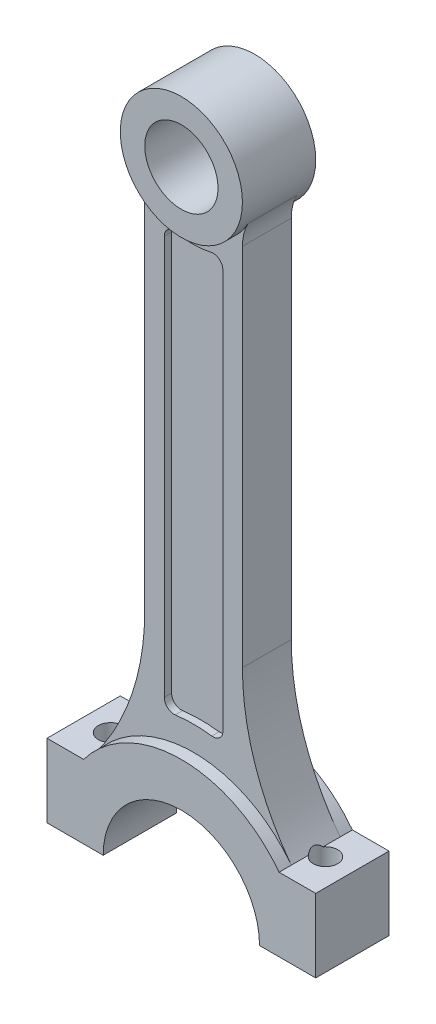
from build123d import *
from build123d.topology import SkipClean

# Parameters (mm, degrees)
BOSS_EXTRUDE1_DEPTH      = 5
BOSS_EXTRUDE1_DEPTH_BACK = 5
SKETCH2_R                = 7.5
BOSS_EXTRUDE2_DEPTH      = 7.5
BOSS_EXTRUDE2_DEPTH_BACK = 7.5
BOSS_EXTRUDE3_DEPTH      = 7.5
BOSS_EXTRUDE3_DEPTH_BACK = 7.5
SKETCH5_R                = 12.5
SKETCH5_R_2              = 7.5
CUT_EXTRUDE1_DEPTH       = 1.5
FILLET1_R                = 10
TAP_DRILL_FOR_M6_TAP1_D  = 5


with BuildPart() as part:
    # Sketch2 → Boss-Extrude1 (new, two sides: drawn at the far end of the back side and taken through both)
    with BuildSketch(Plane.XY.offset(-BOSS_EXTRUDE1_DEPTH_BACK)):
        with BuildLine():
            Line((-27.5, 0), (-16, 0))
            ThreePointArc((-16, 0), (0, 16), (16, 0))
            Line((16, 0), (27.5, 0))
            Line((27.5, 0), (27.5, 15))
            Line((27.5, 15), (20, 15))
            ThreePointArc((20, 15), (12.565835097, 29.188611699), (10, 45))
            Line((10, 45), (10, 122.5))
            ThreePointArc((10, 122.5), (0, 142.5), (-10, 122.5))
            Line((-10, 122.5), (-10, 45))
            ThreePointArc((-10, 45), (-12.565835097, 29.188611699), (-20, 15))
            Line((-20, 15), (-27.5, 15))
            Line((-27.5, 15), (-27.5, 0))
        make_face()
        with Locations((0, 130)):
            Circle(SKETCH2_R, mode=Mode.SUBTRACT)
    extrude(amount=BOSS_EXTRUDE1_DEPTH + BOSS_EXTRUDE1_DEPTH_BACK)

    # Sketch3 → Boss-Extrude2 (add, two sides: drawn at the far end of the back side and taken through both)
    with BuildSketch(Plane.XY.offset(-BOSS_EXTRUDE2_DEPTH_BACK)):
        with BuildLine():
            Line((-27.5, 15), (-27.5, 0))
            Line((-27.5, 0), (-16, 0))
            ThreePointArc((-16, 0), (0, 16), (16, 0))
            Line((16, 0), (27.5, 0))
            Line((27.5, 0), (27.5, 15))
            Line((27.5, 15), (20, 15))
            ThreePointArc((20, 15), (0, 25), (-20, 15))
            Line((-20, 15), (-27.5, 15))
        make_face()
    extrude(amount=BOSS_EXTRUDE2_DEPTH + BOSS_EXTRUDE2_DEPTH_BACK)

    # Sketch5 → Boss-Extrude3 (add, two sides: drawn at the far end of the back side and taken through both)
    with SkipClean():  # the faces are left unmerged after this step: merging them gives an invalid solid
        with BuildSketch(Plane.XY.offset(-BOSS_EXTRUDE3_DEPTH_BACK)):
            with Locations((0, 130)):
                Circle(SKETCH5_R)
            with Locations((0, 130)):
                Circle(SKETCH5_R_2, mode=Mode.SUBTRACT)
        extrude(amount=BOSS_EXTRUDE3_DEPTH + BOSS_EXTRUDE3_DEPTH_BACK)
    add(part.part.scale(1), mode=Mode.REPLACE)  # the faces are merged on a copy

    # Sketch6 → Cut-Extrude1 (cut)
    with BuildSketch(Plane.XY.offset(5)):
        with BuildLine():
            Line((-6, 31.749015733), (-6, 113.477288358))
            ThreePointArc((-6, 113.477288358), (-5.236693885, 115.049098854), (-3.529411765, 115.421136787))
            ThreePointArc((-3.529411765, 115.421136787), (0, 115), (3.529411765, 115.421136787))
            ThreePointArc((3.529411765, 115.421136787), (5.236693885, 115.049098854), (6, 113.477288358))
            Line((6, 113.477288358), (6, 31.749015733))
            ThreePointArc((6, 31.749015733), (5.322875656, 30.249015733), (3.75, 29.764702249))
            ThreePointArc((3.75, 29.764702249), (0, 30), (-3.75, 29.764702249))
            ThreePointArc((-3.75, 29.764702249), (-5.322875656, 30.249015733), (-6, 31.749015733))
        make_face()
    cut_extrude1 = extrude(amount=-CUT_EXTRUDE1_DEPTH, mode=Mode.SUBTRACT)

    # Mirror1: Cut-Extrude1 across plane
    add(cut_extrude1.mirror(Plane.XY), mode=Mode.SUBTRACT)

    # Fillet1
    # the kernel refuses this fillet: 10 mm, written as the material it adds along each edge
    with BuildSketch(Plane(origin=(-10, 122.5, 5), x_dir=(0, -1, 0), z_dir=(0, 0, -1))) as fillet1_piece_1:
        with BuildLine():
            CenterArc((2.807764064, 10), FILLET1_R, 242.733955549, 27.266044451)
            ThreePointArc((-1.773464409, 1.111111111), (-0.863438171, 0.592735581), (0, 0))
            Line((0, 0), (2.807764064, 0))
        make_face()
    extrude(amount=10)
    with BuildSketch(Plane(origin=(10, 122.5, 5), x_dir=(0.5309249463264099, 0.8474188464792949, 0), z_dir=(0, 0, -1))) as fillet1_piece_2:
        with BuildLine():
            CenterArc((2.929897279, 9.96490045), FILLET1_R, 237.932028952, 27.266044451)
            Line((-2.379352184, 1.490711985), (0, 0))
            ThreePointArc((0, 0), (1.046391885, 0.043874438), (2.092783771, 0))
        make_face()
    extrude(amount=10)

    # Tap Drill for M6 Tap1 (through all)
    with Locations(Plane(origin=(0, 0, 0), x_dir=(-1, 0, 0), z_dir=(0, -1, 0))):
        with Locations((22, 0), (-22, 0)):
            Hole(TAP_DRILL_FOR_M6_TAP1_D / 2)


solid = part.part
